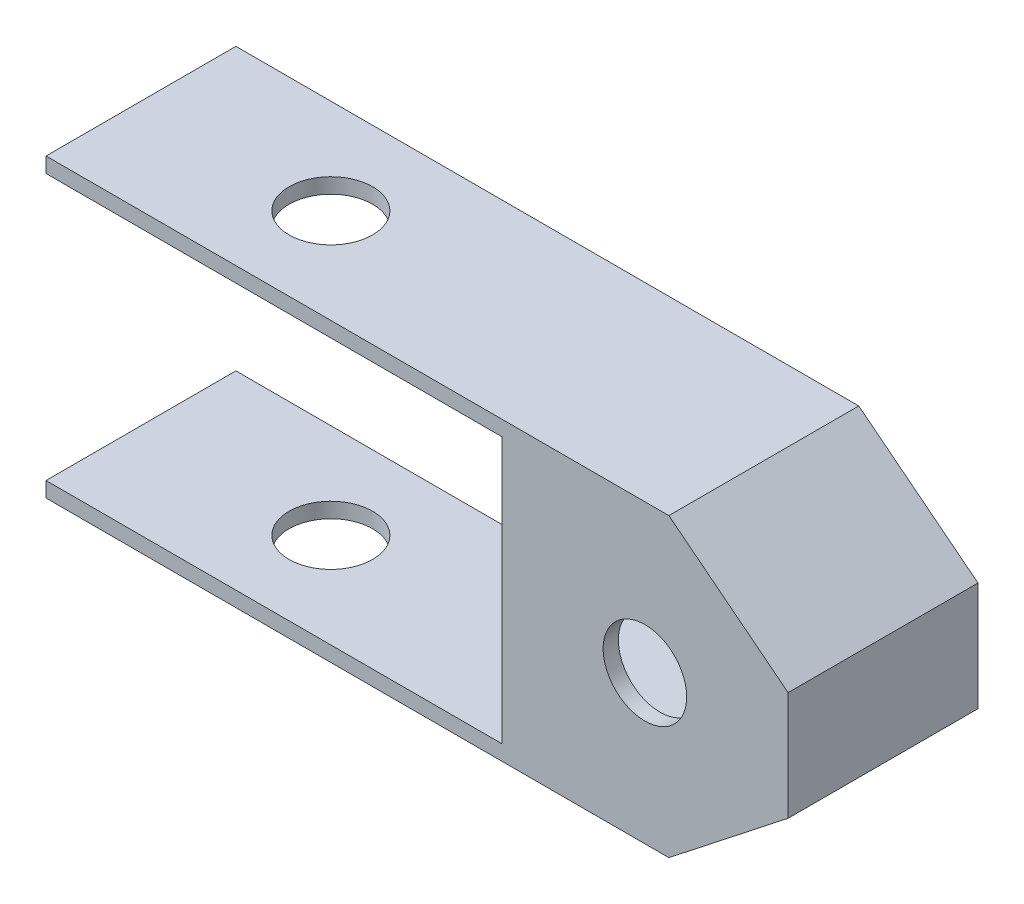
from build123d import *

# Parameters (mm, degrees)
RESSALTO_EXTRUS_O2_DEPTH = 25
ESBO_O6_W                = 60
ESBO_O6_H                = 35
CORTE_EXTRUS_O4_DEPTH    = 25
ESBO_O7_R                = 5.5
CORTE_EXTRUS_O5_DEPTH    = 67
CASCA3_START             = 2
CASCA3_DEPTH             = 21
CORTE_EXTRUS_O7_DEPTH    = 67


# Read off the part's stored shape, not the designer's step: Casca3
with BuildPart() as part:
    # Esboço1 → Ressalto-extrusão2 (new body)
    with BuildSketch(Plane.XY):
        Polygon((-60, 2), (-60, 0), (-60, -35), (-60, -37), (2, -37), (22, -37), (37.696905261, -24.665320756), (37.696905261, -10.334679244), (22, 2), (2, 2), align=None)
    extrude(amount=RESSALTO_EXTRUS_O2_DEPTH)

    # Esboço6 → Corte-extrusão4 (cut)
    with BuildSketch(Plane.XY.offset(25)):
        with Locations((-30, -17.5)):
            Rectangle(ESBO_O6_W, ESBO_O6_H)
    extrude(amount=-CORTE_EXTRUS_O4_DEPTH, mode=Mode.SUBTRACT)

    # Esboço7 → Corte-extrusão5 (cut)
    with BuildSketch(Plane(origin=(0, 2, 0), x_dir=(1, 0, 0), z_dir=(0, 1, 0))):
        with Locations(Location((-35, -12.5, 0), (0, 0, 270))):
            Circle(ESBO_O7_R)
    extrude(amount=-CORTE_EXTRUS_O5_DEPTH, mode=Mode.SUBTRACT)

    # Casca3 outline → Casca3 (cut)
    with BuildSketch(Plane.XY.offset(CASCA3_START)):
        Polygon((0, -35), (21.308212264, -35), (35.696905261, -23.693318211), (35.696905261, -11.306681789), (21.308212264, 0), (0, 0), align=None)
    extrude(amount=CASCA3_DEPTH, mode=Mode.SUBTRACT)

    # Esboço8 → Corte-extrusão7 (cut)
    with BuildSketch(Plane.XY.offset(25)):
        with BuildLine():
            ThreePointArc((13.34845263, -17.5), (18.84845263, -23), (24.34845263, -17.5))
            Line((24.34845263, -17.5), (13.34845263, -17.5))
        make_face()
        with BuildLine():
            Line((13.34845263, -17.5), (24.34845263, -17.5))
            ThreePointArc((24.34845263, -17.5), (18.84845263, -12), (13.34845263, -17.5))
        make_face()
    extrude(amount=-CORTE_EXTRUS_O7_DEPTH, mode=Mode.SUBTRACT)


solid = part.part
